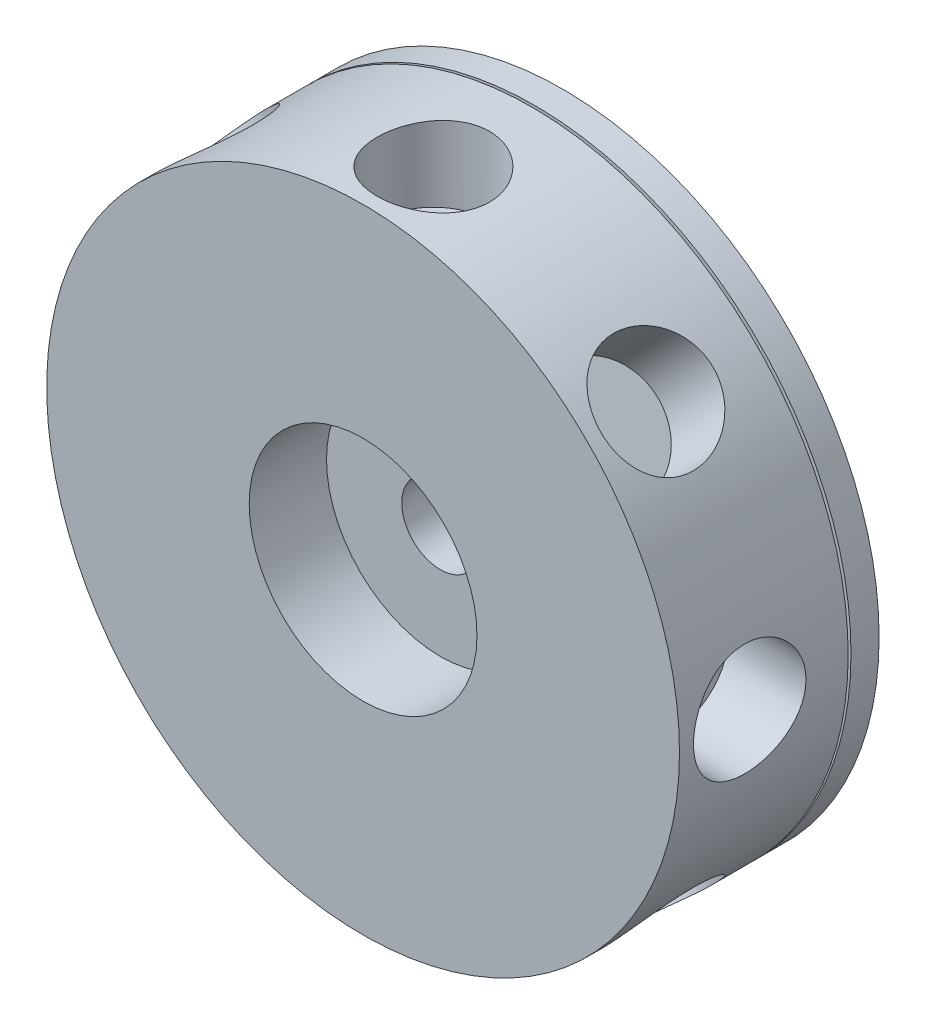
from build123d import *

# Parameters (mm, degrees)
SKETCH3_R                 = 22.5
BOSS_EXTRUDE3_DEPTH       = 14.2
SKETCH8_R                 = 4
CUT_EXTRUDE4_DEPTH        = 5.5
SKETCH6_R                 = 2.75
CUT_EXTRUDE6_DEPTH        = 14.2
CIRPATTERN1_COUNT         = 8
SKETCH5_R                 = 8.1
CUT_EXTRUDE7_DEPTH        = 5.5
BOUNDARY_CUT1_START       = -12.2
BOUNDARY_CUT1_OUTLINE_R   = 22.5
BOUNDARY_CUT1_OUTLINE_R_2 = 22
BOUNDARY_CUT1_DEPTH       = 0.2


# Read off the part's stored shape, not the designer's step: Boundary-Cut1
with BuildPart() as part:
    # Sketch3 → Boss-Extrude3 (new body)
    with BuildSketch(Plane.XY):
        Circle(SKETCH3_R)
    extrude(amount=-BOSS_EXTRUDE3_DEPTH)

    # Sketch8 → Cut-Extrude4 (cut)
    with BuildSketch(Plane(origin=(22.5, 0, 0), x_dir=(0, 0, -1), z_dir=(1, 0, 0))):
        with Locations((5, 0)):
            Circle(SKETCH8_R)
    cut_extrude4 = extrude(amount=-CUT_EXTRUDE4_DEPTH, mode=Mode.SUBTRACT)

    # Sketch6 → Cut-Extrude6 (cut)
    with BuildSketch(Plane.XY):
        Circle(SKETCH6_R)
    extrude(amount=-CUT_EXTRUDE6_DEPTH, mode=Mode.SUBTRACT)

    # CirPattern1: Cut-Extrude4 ×8 about axis
    cirpattern1_axis = Axis((0, 0, 0), (0, 0, 1))
    for i in range(1, CIRPATTERN1_COUNT):
        add(cut_extrude4.rotate(cirpattern1_axis, i * 360 / CIRPATTERN1_COUNT), mode=Mode.SUBTRACT)

    # Sketch5 → Cut-Extrude7 (cut)
    with BuildSketch(Plane.XY):
        Circle(SKETCH5_R)
    extrude(amount=-CUT_EXTRUDE7_DEPTH, mode=Mode.SUBTRACT)

    # Boundary-Cut1 outline → Boundary-Cut1 (cut)
    with BuildSketch(Plane.XY.offset(BOUNDARY_CUT1_START)):
        Circle(BOUNDARY_CUT1_OUTLINE_R)
        Circle(BOUNDARY_CUT1_OUTLINE_R_2, mode=Mode.SUBTRACT)
    extrude(amount=BOUNDARY_CUT1_DEPTH, mode=Mode.SUBTRACT)


solid = part.part
